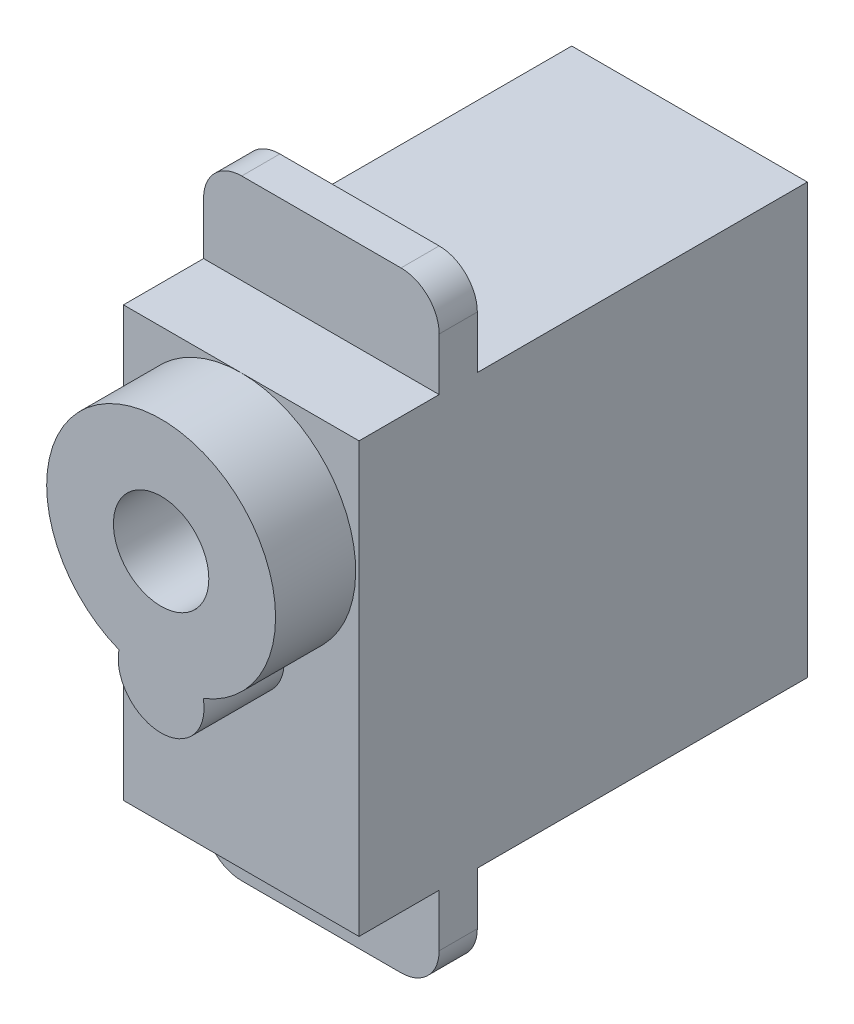
from build123d import *

# Parameters (mm, degrees)
SKETCH3_W           = 22.5
SKETCH3_H           = 23.5
BOSS_EXTRUDE1_DEPTH = 6.175
SKETCH4_W           = 12.35
SKETCH4_H           = 32
BOSS_EXTRUDE2_DEPTH = 2
BOSS_EXTRUDE3_DEPTH = 4.2
SKETCH6_R           = 2.5
CUT_EXTRUDE1_DEPTH  = 4.2
FILLET1_R           = 2


with BuildPart() as part:
    # Sketch3 → Boss-Extrude1 (new, symmetric)
    with BuildSketch(Plane(origin=(0, -28.275548605, 0), x_dir=(0, 1, 0), z_dir=(1, 0, 0))):
        with Locations((24.609729517, 167.116706922)):
            Rectangle(SKETCH3_W, SKETCH3_H)
    extrude(amount=BOSS_EXTRUDE1_DEPTH, both=True)

    # Sketch4 → Boss-Extrude2 (add)
    with BuildSketch(Plane.XY.offset(174.666706922)):
        with Locations((0, -3.665819089)):
            Rectangle(SKETCH4_W, SKETCH4_H)
    extrude(amount=-BOSS_EXTRUDE2_DEPTH)

    # Sketch5 → Boss-Extrude3 (add)
    with BuildSketch(Plane.XY.offset(178.866706922)):
        with BuildLine():
            ThreePointArc((2.210095356, -3.993944089), (0, 7.584180911), (-2.210095356, -3.993944089))
            ThreePointArc((-2.210095356, -3.993944089), (0, -6.665819089), (2.210095356, -3.993944089))
        make_face()
    extrude(amount=BOSS_EXTRUDE3_DEPTH)

    # Sketch6 → Cut-Extrude1 (cut)
    with BuildSketch(Plane.XY.offset(183.066706922)):
        with Locations((0, 1.584180911)):
            Circle(SKETCH6_R)
    extrude(amount=-CUT_EXTRUDE1_DEPTH, mode=Mode.SUBTRACT)

    # Fillet1
    fillet1_edges = [part.edges().sort_by_distance(p)[0] for p in [
        (6.175, -19.665819089, 173.666706922),
        (-6.175, -19.665819089, 173.666706922),
        (6.175, 12.334180911, 173.666706922),
        (-6.175, 12.334180911, 173.666706922),
    ]]
    fillet(fillet1_edges, radius=FILLET1_R)


solid = part.part
